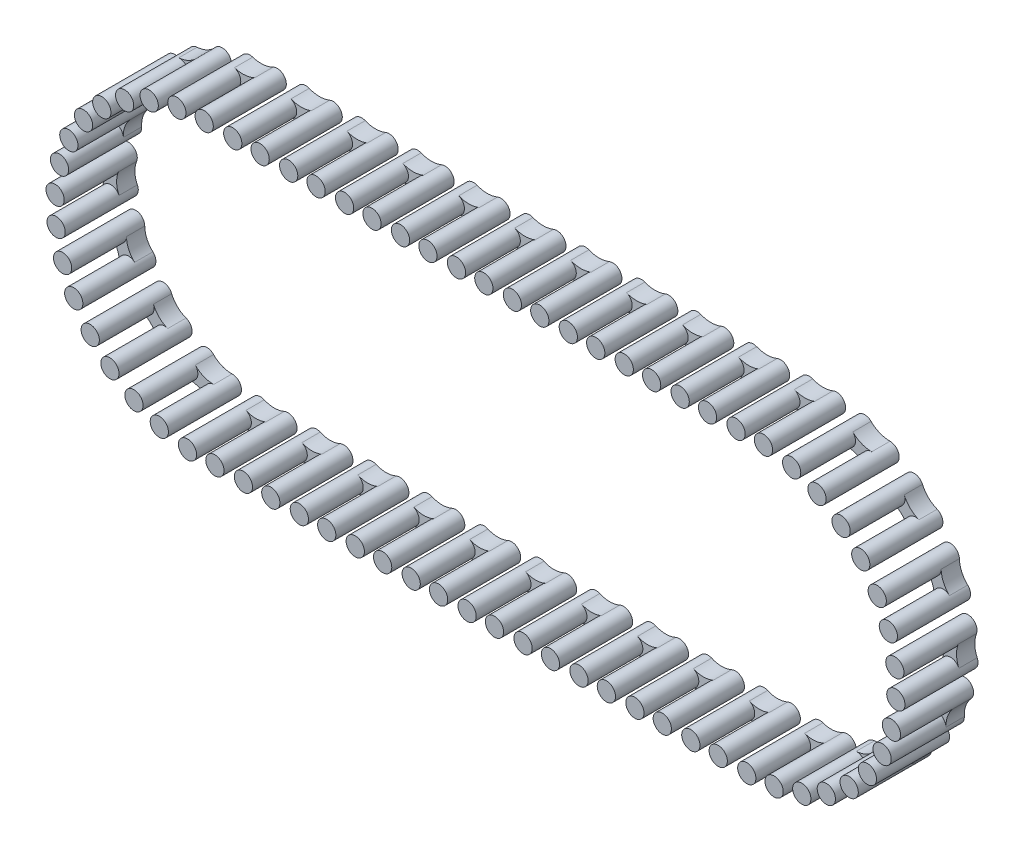
from build123d import *

# Parameters (mm, degrees)
BOSS_EXTRUDE1_DEPTH   = 2
CUT_EXTRUDE1_DEPTH    = 3
CRVPATTERN1_START     = -2
CRVPATTERN1_OUTLINE_R = 0.5
CRVPATTERN1_DEPTH     = 4
CRVPATTERN1_2_DEPTH   = 1


# Read off the part's stored shape, not the designer's step: CrvPattern1
with BuildPart() as part:
    # Sketch1 → Boss-Extrude1 (new, symmetric)
    with BuildSketch(Plane.XY):
        with BuildLine():
            ThreePointArc((10.132893716, 15.543142697), (10.608478721, 15.580721376), (10.836071975, 16))
            Line((10.836071975, 16), (9.836071975, 16))
            ThreePointArc((9.836071975, 16), (9.916793351, 15.727593254), (10.132893716, 15.543142697))
        make_face()
        with BuildLine():
            Line((9.836071975, 16), (10.836071975, 16))
            ThreePointArc((10.836071975, 16), (10.614498184, 16.415305726), (10.14615659, 16.462527995))
            ThreePointArc((10.14615659, 16.462527995), (9.920766249, 16.278426209), (9.836071975, 16))
        make_face()
        with BuildLine():
            Line((9.336071975, 16), (9.836071975, 16))
            ThreePointArc((9.836071975, 16), (9.920766249, 16.278426209), (10.14615659, 16.462527995))
            ThreePointArc((10.14615659, 16.462527995), (9.586071975, 16.35201829), (9.02598736, 16.462527995))
            ThreePointArc((9.02598736, 16.462527995), (9.251377702, 16.278426209), (9.336071975, 16))
        make_face()
        with BuildLine():
            ThreePointArc((9.039250234, 15.543142697), (9.2553506, 15.727593254), (9.336071975, 16))
            Line((9.336071975, 16), (8.336071975, 16))
            ThreePointArc((8.336071975, 16), (8.563665229, 15.580721376), (9.039250234, 15.543142697))
        make_face()
        with BuildLine():
            Line((8.336071975, 16), (9.336071975, 16))
            ThreePointArc((9.336071975, 16), (9.251377702, 16.278426209), (9.02598736, 16.462527995))
            ThreePointArc((9.02598736, 16.462527995), (8.557645767, 16.415305726), (8.336071975, 16))
        make_face()
        with BuildLine():
            ThreePointArc((9.039250234, 15.543142697), (9.2553506, 15.727593254), (9.336071975, 16))
            Line((9.336071975, 16), (8.336071975, 16))
            ThreePointArc((8.336071975, 16), (8.563665229, 15.580721376), (9.039250234, 15.543142697))
        make_face()
        with BuildLine():
            Line((8.336071975, 16), (9.336071975, 16))
            ThreePointArc((9.336071975, 16), (9.251377702, 16.278426209), (9.02598736, 16.462527995))
            ThreePointArc((9.02598736, 16.462527995), (8.557645767, 16.415305726), (8.336071975, 16))
        make_face()
        with BuildLine():
            ThreePointArc((10.132893716, 15.543142697), (9.916793351, 15.727593254), (9.836071975, 16))
            Line((9.836071975, 16), (9.336071975, 16))
            ThreePointArc((9.336071975, 16), (9.2553506, 15.727593254), (9.039250234, 15.543142697))
            ThreePointArc((9.039250234, 15.543142697), (9.586071975, 15.659254357), (10.132893716, 15.543142697))
        make_face()
        with BuildLine():
            ThreePointArc((10.132893716, 15.543142697), (10.608478721, 15.580721376), (10.836071975, 16))
            Line((10.836071975, 16), (9.836071975, 16))
            ThreePointArc((9.836071975, 16), (9.916793351, 15.727593254), (10.132893716, 15.543142697))
        make_face()
        with BuildLine():
            Line((9.836071975, 16), (10.836071975, 16))
            ThreePointArc((10.836071975, 16), (10.614498184, 16.415305726), (10.14615659, 16.462527995))
            ThreePointArc((10.14615659, 16.462527995), (9.920766249, 16.278426209), (9.836071975, 16))
        make_face()
    extrude(amount=BOSS_EXTRUDE1_DEPTH, both=True)

    # Sketch2 → Cut-Extrude1 (cut)
    with BuildSketch(Plane.XY.offset(2)):
        with BuildLine():
            ThreePointArc((9.039250234, 15.543142697), (9.336019957, 16.007212153), (9.02598736, 16.462527995))
            ThreePointArc((9.02598736, 16.462527995), (9.586071975, 16.35201829), (10.14615659, 16.462527995))
            ThreePointArc((10.14615659, 16.462527995), (9.836123993, 16.007212153), (10.132893716, 15.543142697))
            ThreePointArc((10.132893716, 15.543142697), (9.586071975, 15.659254357), (9.039250234, 15.543142697))
        make_face()
    extrude(amount=-CUT_EXTRUDE1_DEPTH, mode=Mode.SUBTRACT)


with BuildPart() as body_2:
    # CrvPattern1 outline → CrvPattern1 (new body)
    with BuildSketch(Plane.XY.offset(CRVPATTERN1_START)):
        with Locations((11.899002044, 16)):
            Circle(CRVPATTERN1_OUTLINE_R)
        with Locations((13.399002044, 16)):
            Circle(CRVPATTERN1_OUTLINE_R)
        with Locations((14.961932112, 16)):
            Circle(CRVPATTERN1_OUTLINE_R)
        with Locations((16.461932112, 16)):
            Circle(CRVPATTERN1_OUTLINE_R)
        with Locations((18.02486218, 16)):
            Circle(CRVPATTERN1_OUTLINE_R)
        with Locations((19.52486218, 16)):
            Circle(CRVPATTERN1_OUTLINE_R)
        with Locations((21.087792248, 16)):
            Circle(CRVPATTERN1_OUTLINE_R)
        with Locations((22.587792248, 16)):
            Circle(CRVPATTERN1_OUTLINE_R)
        with Locations((24.150722317, 16)):
            Circle(CRVPATTERN1_OUTLINE_R)
        with Locations((25.650722317, 16)):
            Circle(CRVPATTERN1_OUTLINE_R)
        with Locations((27.213654163, 16.002097164)):
            Circle(CRVPATTERN1_OUTLINE_R)
        with Locations((28.713648117, 15.99783835)):
            Circle(CRVPATTERN1_OUTLINE_R)
        with Locations((30.255580855, 15.694457115)):
            Circle(CRVPATTERN1_OUTLINE_R)
        with Locations((31.645380738, 15.130137805)):
            Circle(CRVPATTERN1_OUTLINE_R)
        with Locations((32.962336566, 14.272685713)):
            Circle(CRVPATTERN1_OUTLINE_R)
        with Locations((34.040692874, 13.230021975)):
            Circle(CRVPATTERN1_OUTLINE_R)
        with Locations((34.941970446, 11.942662088)):
            Circle(CRVPATTERN1_OUTLINE_R)
        with Locations((35.552732158, 10.572636493)):
            Circle(CRVPATTERN1_OUTLINE_R)
        with Locations((35.90782228, 9.041784525)):
            Circle(CRVPATTERN1_OUTLINE_R)
        with Locations((35.962548251, 7.542783168)):
            Circle(CRVPATTERN1_OUTLINE_R)
        with Locations((35.720032216, 5.990113624)):
            Circle(CRVPATTERN1_OUTLINE_R)
        with Locations((35.21079787, 4.579198892)):
            Circle(CRVPATTERN1_OUTLINE_R)
        with Locations((34.405793133, 3.229545561)):
            Circle(CRVPATTERN1_OUTLINE_R)
        with Locations((33.406337978, 2.111024487)):
            Circle(CRVPATTERN1_OUTLINE_R)
        with Locations((32.155412977, 1.159823466)):
            Circle(CRVPATTERN1_OUTLINE_R)
        with Locations((30.810462781, 0.495663116)):
            Circle(CRVPATTERN1_OUTLINE_R)
        with Locations((29.29475729, 0.080652749)):
            Circle(CRVPATTERN1_OUTLINE_R)
        with Locations((27.799067112, -0.03297336)):
            Circle(CRVPATTERN1_OUTLINE_R)
        with Locations((26.234595587, 0.000855204)):
            Circle(CRVPATTERN1_OUTLINE_R)
        with Locations((24.734595587, 0.000855204)):
            Circle(CRVPATTERN1_OUTLINE_R)
        with Locations((23.171665519, 0.000855204)):
            Circle(CRVPATTERN1_OUTLINE_R)
        with Locations((21.671665519, 0.000855204)):
            Circle(CRVPATTERN1_OUTLINE_R)
        with Locations((20.10873545, 0.000855204)):
            Circle(CRVPATTERN1_OUTLINE_R)
        with Locations((18.60873545, 0.000855204)):
            Circle(CRVPATTERN1_OUTLINE_R)
        with Locations((17.045805382, 0.000855204)):
            Circle(CRVPATTERN1_OUTLINE_R)
        with Locations((15.545805382, 0.000855204)):
            Circle(CRVPATTERN1_OUTLINE_R)
        with Locations((13.982875314, 0.000855204)):
            Circle(CRVPATTERN1_OUTLINE_R)
        with Locations((12.482875314, 0.000855204)):
            Circle(CRVPATTERN1_OUTLINE_R)
        with Locations((10.919945246, 0.000855204)):
            Circle(CRVPATTERN1_OUTLINE_R)
        with Locations((9.419945246, 0.000855204)):
            Circle(CRVPATTERN1_OUTLINE_R)
        with Locations((7.857015177, 0.000855204)):
            Circle(CRVPATTERN1_OUTLINE_R)
        with Locations((6.357015177, 0.000855204)):
            Circle(CRVPATTERN1_OUTLINE_R)
        with Locations((4.794085109, 0.000855204)):
            Circle(CRVPATTERN1_OUTLINE_R)
        with Locations((3.294085109, 0.000855204)):
            Circle(CRVPATTERN1_OUTLINE_R)
        with Locations((1.731155041, 0.000855204)):
            Circle(CRVPATTERN1_OUTLINE_R)
        with Locations((0.231155041, 0.000855204)):
            Circle(CRVPATTERN1_OUTLINE_R)
        with Locations((-1.331776806, -0.001241961)):
            Circle(CRVPATTERN1_OUTLINE_R)
        with Locations((-2.83177076, 0.003016854)):
            Circle(CRVPATTERN1_OUTLINE_R)
        with Locations((-4.373703497, 0.306398089)):
            Circle(CRVPATTERN1_OUTLINE_R)
        with Locations((-5.763503381, 0.870717399)):
            Circle(CRVPATTERN1_OUTLINE_R)
        with Locations((-7.080459208, 1.72816949)):
            Circle(CRVPATTERN1_OUTLINE_R)
        with Locations((-8.158815517, 2.770833229)):
            Circle(CRVPATTERN1_OUTLINE_R)
        with Locations((-9.060093089, 4.058193116)):
            Circle(CRVPATTERN1_OUTLINE_R)
        with BuildLine():
            ThreePointArc((-9.170855001, 5.4286664), (-10.170854751, 5.427994866), (-9.170854801, 5.428218711))
            ThreePointArc((-9.170854801, 5.428218711), (-9.170854782, 5.428442556), (-9.170855001, 5.4286664))
        make_face()
        with Locations((-10.025944922, 6.959070678)):
            Circle(CRVPATTERN1_OUTLINE_R)
        with Locations((-10.080670893, 8.458072035)):
            Circle(CRVPATTERN1_OUTLINE_R)
        with Locations((-9.838154859, 10.01074158)):
            Circle(CRVPATTERN1_OUTLINE_R)
        with Locations((-9.328920513, 11.421656312)):
            Circle(CRVPATTERN1_OUTLINE_R)
        with Locations((-8.523915775, 12.771309642)):
            Circle(CRVPATTERN1_OUTLINE_R)
        with Locations((-7.524460621, 13.889830717)):
            Circle(CRVPATTERN1_OUTLINE_R)
        with Locations((-6.27353562, 14.841031738)):
            Circle(CRVPATTERN1_OUTLINE_R)
        with Locations((-4.928585423, 15.505192087)):
            Circle(CRVPATTERN1_OUTLINE_R)
        with Locations((-3.412879933, 15.920202455)):
            Circle(CRVPATTERN1_OUTLINE_R)
        with Locations((-1.917189755, 16.033828564)):
            Circle(CRVPATTERN1_OUTLINE_R)
        with Locations((-0.35271823, 16)):
            Circle(CRVPATTERN1_OUTLINE_R)
        with Locations((1.14728177, 16)):
            Circle(CRVPATTERN1_OUTLINE_R)
        with Locations((2.710211839, 16)):
            Circle(CRVPATTERN1_OUTLINE_R)
        with Locations((4.210211839, 16)):
            Circle(CRVPATTERN1_OUTLINE_R)
        with Locations((5.773141907, 16)):
            Circle(CRVPATTERN1_OUTLINE_R)
        with Locations((7.273141907, 16)):
            Circle(CRVPATTERN1_OUTLINE_R)
    extrude(amount=CRVPATTERN1_DEPTH)

    # CrvPattern1 2 outline → CrvPattern1 2 (add)
    with BuildSketch(Plane.XY.offset(CRVPATTERN1_START)):
        with BuildLine():
            ThreePointArc((12.088917429, 16.462527995), (12.398950026, 16.007212152), (12.102180303, 15.543142697))
            ThreePointArc((12.102180303, 15.543142697), (12.649002044, 15.659254357), (13.195823784, 15.543142697))
            ThreePointArc((13.195823784, 15.543142697), (12.899054062, 16.007212152), (13.209086658, 16.462527995))
            ThreePointArc((13.209086658, 16.462527995), (12.649002044, 16.35201829), (12.088917429, 16.462527995))
        make_face()
        with BuildLine():
            ThreePointArc((15.151847497, 16.462527995), (15.461880094, 16.007212152), (15.165110371, 15.543142697))
            ThreePointArc((15.165110371, 15.543142697), (15.711932112, 15.659254357), (16.258753853, 15.543142697))
            ThreePointArc((16.258753853, 15.543142697), (15.96198413, 16.007212152), (16.272016727, 16.462527995))
            ThreePointArc((16.272016727, 16.462527995), (15.711932112, 16.35201829), (15.151847497, 16.462527995))
        make_face()
        with BuildLine():
            ThreePointArc((18.214777565, 16.462527995), (18.524810162, 16.007212152), (18.228040439, 15.543142697))
            ThreePointArc((18.228040439, 15.543142697), (18.77486218, 15.659254357), (19.321683921, 15.543142697))
            ThreePointArc((19.321683921, 15.543142697), (19.024914198, 16.007212152), (19.334946795, 16.462527995))
            ThreePointArc((19.334946795, 16.462527995), (18.77486218, 16.35201829), (18.214777565, 16.462527995))
        make_face()
        with BuildLine():
            ThreePointArc((21.277707634, 16.462527995), (21.58774023, 16.007212152), (21.290970507, 15.543142697))
            ThreePointArc((21.290970507, 15.543142697), (21.837792248, 15.659254357), (22.384613989, 15.543142697))
            ThreePointArc((22.384613989, 15.543142697), (22.087844266, 16.007212152), (22.397876863, 16.462527995))
            ThreePointArc((22.397876863, 16.462527995), (21.837792248, 16.35201829), (21.277707634, 16.462527995))
        make_face()
        with BuildLine():
            ThreePointArc((24.340637702, 16.462527995), (24.650670299, 16.007212152), (24.353900576, 15.543142697))
            ThreePointArc((24.353900576, 15.543142697), (24.900722317, 15.659254357), (25.447544057, 15.543142697))
            ThreePointArc((25.447544057, 15.543142697), (25.150774335, 16.007212152), (25.460806931, 16.462527995))
            ThreePointArc((25.460806931, 16.462527995), (24.900722316, 16.35201829), (24.340637702, 16.462527995))
        make_face()
        with BuildLine():
            ThreePointArc((27.404881997, 16.464084085), (27.713620607, 16.007889831), (27.41553449, 15.544664837))
            ThreePointArc((27.41553449, 15.544664837), (27.962683692, 15.659223487), (28.509173564, 15.541559754))
            ThreePointArc((28.509173564, 15.541559754), (28.213722627, 16.00646993), (28.525046711, 16.460903691))
            ThreePointArc((28.525046711, 16.460903691), (27.964650594, 16.351984628), (27.404881997, 16.464084085))
        make_face()
        with BuildLine():
            ThreePointArc((30.605552761, 16.051556072), (30.721512591, 15.513052547), (30.27195667, 15.194725354))
            ThreePointArc((30.27195667, 15.194725354), (30.822287899, 15.09658529), (31.285253726, 14.783282598))
            ThreePointArc((31.285253726, 14.783282598), (31.184875611, 15.324906971), (31.643426804, 15.630133987))
            ThreePointArc((31.643426804, 15.630133987), (31.082914609, 15.738454112), (30.605552761, 16.051556072))
        make_face()
        with BuildLine():
            ThreePointArc((33.420374981, 14.473187111), (33.326764506, 13.930352138), (32.790836575, 13.803018008))
            ThreePointArc((32.790836575, 13.803018008), (33.264659303, 13.506390368), (33.577061474, 13.042816407))
            ThreePointArc((33.577061474, 13.042816407), (33.6862914, 13.582725243), (34.225669351, 13.69454722))
            ThreePointArc((34.225669351, 13.69454722), (33.746205857, 14.004421273), (33.420374981, 14.473187111))
        make_face()
        with BuildLine():
            ThreePointArc((35.441749271, 11.957532389), (35.152123726, 11.488971005), (34.607428649, 11.571068512))
            ThreePointArc((34.607428649, 11.571068512), (34.936131134, 11.118906362), (35.052732359, 10.572188804))
            ThreePointArc((35.052732359, 10.572188804), (35.355753323, 11.032200785), (35.897853589, 10.934425379))
            ThreePointArc((35.897853589, 10.934425379), (35.568867347, 11.400982153), (35.441749271, 11.957532389))
        make_face()
        with BuildLine():
            ThreePointArc((36.376971211, 8.868870441), (35.933269724, 8.542432517), (35.458681887, 8.822073561))
            ThreePointArc((35.458681887, 8.822073561), (35.594666478, 8.279852089), (35.498582355, 7.729158186))
            ThreePointArc((35.498582355, 7.729158186), (35.95151551, 8.042661432), (36.417839443, 7.749446977))
            ThreePointArc((36.417839443, 7.749446977), (36.286969194, 8.305126875), (36.376971211, 8.868870441))
        make_face()
        with BuildLine():
            ThreePointArc((36.0906163, 5.65445392), (35.557088915, 5.517409191), (35.221330852, 5.954100444))
            ThreePointArc((35.221330852, 5.954100444), (35.144906345, 5.400335847), (34.850050303, 4.925408644))
            ThreePointArc((34.850050303, 4.925408644), (35.387308814, 5.047006424), (35.710330536, 4.600811741))
            ThreePointArc((35.710330536, 4.600811741), (35.796526904, 5.165149722), (36.0906163, 5.65445392))
        make_face()
        with BuildLine():
            ThreePointArc((34.624150066, 2.779745328), (34.078054038, 2.85193851), (33.92974508, 3.382445042))
            ThreePointArc((33.92974508, 3.382445042), (33.6519781, 2.897325017), (33.20104667, 2.566936187))
            ThreePointArc((33.20104667, 2.566936187), (33.744833, 2.479020574), (33.877777459, 1.944456735))
            ThreePointArc((33.877777459, 1.944456735), (34.168558806, 2.435734028), (34.624150066, 2.779745328))
        make_face()
        with BuildLine():
            ThreePointArc((32.189923657, 0.661015875), (31.710336236, 0.931993058), (31.770952214, 1.47949505))
            ThreePointArc((31.770952214, 1.47949505), (31.332064715, 1.133267238), (30.79035487, 0.995258625))
            ThreePointArc((30.79035487, 0.995258625), (31.261926223, 0.71056021), (31.185542441, 0.16503455))
            ThreePointArc((31.185542441, 0.16503455), (31.638802272, 0.512111913), (32.189923657, 0.661015875))
        make_face()
        with BuildLine():
            ThreePointArc((29.14042441, -0.394932535), (28.796792092, 0.035589889), (29.057555527, 0.520806499))
            ThreePointArc((29.057555527, 0.520806499), (28.521100467, 0.363606302), (27.967054318, 0.437962197))
            ThreePointArc((27.967054318, 0.437962197), (28.298124962, -0.002293361), (28.023473667, -0.479786182))
            ThreePointArc((28.023473667, -0.479786182), (28.573577847, -0.327167171), (29.14042441, -0.394932535))
        make_face()
        with BuildLine():
            ThreePointArc((26.044680202, -0.461672791), (25.734647605, -0.006356949), (26.031417328, 0.457712507))
            ThreePointArc((26.031417328, 0.457712507), (25.484595587, 0.341600847), (24.937773846, 0.457712506))
            ThreePointArc((24.937773846, 0.457712506), (25.234543569, -0.006356949), (24.924510972, -0.461672791))
            ThreePointArc((24.924510972, -0.461672791), (25.484595587, -0.351163086), (26.044680202, -0.461672791))
        make_face()
        with BuildLine():
            ThreePointArc((22.981750133, -0.461672791), (22.671717537, -0.006356949), (22.968487259, 0.457712506))
            ThreePointArc((22.968487259, 0.457712506), (22.421665518, 0.341600847), (21.874843778, 0.457712506))
            ThreePointArc((21.874843778, 0.457712506), (22.171613501, -0.006356949), (21.861580904, -0.461672791))
            ThreePointArc((21.861580904, -0.461672791), (22.421665518, -0.351163086), (22.981750133, -0.461672791))
        make_face()
        with BuildLine():
            ThreePointArc((19.918820065, -0.461672791), (19.608787468, -0.006356949), (19.905557191, 0.457712507))
            ThreePointArc((19.905557191, 0.457712507), (19.35873545, 0.341600847), (18.811913709, 0.457712506))
            ThreePointArc((18.811913709, 0.457712506), (19.108683432, -0.006356948), (18.798650836, -0.461672791))
            ThreePointArc((18.798650836, -0.461672791), (19.35873545, -0.351163086), (19.918820065, -0.461672791))
        make_face()
        with BuildLine():
            ThreePointArc((16.855889997, -0.461672791), (16.5458574, -0.006356949), (16.842627123, 0.457712507))
            ThreePointArc((16.842627123, 0.457712507), (16.295805382, 0.341600847), (15.748983641, 0.457712506))
            ThreePointArc((15.748983641, 0.457712506), (16.045753364, -0.006356949), (15.735720767, -0.461672791))
            ThreePointArc((15.735720767, -0.461672791), (16.295805382, -0.351163086), (16.855889997, -0.461672791))
        make_face()
        with BuildLine():
            ThreePointArc((13.792959929, -0.461672791), (13.482927332, -0.006356949), (13.779697055, 0.457712507))
            ThreePointArc((13.779697055, 0.457712507), (13.232875314, 0.341600847), (12.686053573, 0.457712506))
            ThreePointArc((12.686053573, 0.457712506), (12.982823296, -0.006356949), (12.672790699, -0.461672791))
            ThreePointArc((12.672790699, -0.461672791), (13.232875314, -0.351163086), (13.792959929, -0.461672791))
        make_face()
        with BuildLine():
            ThreePointArc((10.73002986, -0.461672791), (10.419997264, -0.006356949), (10.716766986, 0.457712506))
            ThreePointArc((10.716766986, 0.457712506), (10.169945246, 0.341600847), (9.623123505, 0.457712506))
            ThreePointArc((9.623123505, 0.457712506), (9.919893228, -0.006356949), (9.609860631, -0.461672791))
            ThreePointArc((9.609860631, -0.461672791), (10.169945246, -0.351163086), (10.73002986, -0.461672791))
        make_face()
        with BuildLine():
            ThreePointArc((7.667099792, -0.461672791), (7.357067195, -0.006356949), (7.653836918, 0.457712507))
            ThreePointArc((7.653836918, 0.457712507), (7.107015177, 0.341600847), (6.560193436, 0.457712506))
            ThreePointArc((6.560193436, 0.457712506), (6.856963159, -0.006356948), (6.546930563, -0.461672791))
            ThreePointArc((6.546930563, -0.461672791), (7.107015178, -0.351163086), (7.667099792, -0.461672791))
        make_face()
        with BuildLine():
            ThreePointArc((4.604169724, -0.461672791), (4.294137127, -0.006356949), (4.59090685, 0.457712507))
            ThreePointArc((4.59090685, 0.457712507), (4.044085109, 0.341600847), (3.497263368, 0.457712506))
            ThreePointArc((3.497263368, 0.457712506), (3.794033091, -0.006356949), (3.484000494, -0.461672791))
            ThreePointArc((3.484000494, -0.461672791), (4.044085109, -0.351163086), (4.604169724, -0.461672791))
        make_face()
        with BuildLine():
            ThreePointArc((1.541239656, -0.461672791), (1.231207059, -0.006356949), (1.527976782, 0.457712507))
            ThreePointArc((1.527976782, 0.457712507), (0.981155041, 0.341600847), (0.4343333, 0.457712506))
            ThreePointArc((0.4343333, 0.457712506), (0.731103023, -0.006356949), (0.421070426, -0.461672791))
            ThreePointArc((0.421070426, -0.461672791), (0.981155041, -0.351163086), (1.541239656, -0.461672791))
        make_face()
        with BuildLine():
            ThreePointArc((-1.523004639, -0.463228883), (-1.83174325, -0.007034627), (-1.533657132, 0.456190366))
            ThreePointArc((-1.533657132, 0.456190366), (-2.080806334, 0.341631716), (-2.627296206, 0.459295449))
            ThreePointArc((-2.627296206, 0.459295449), (-2.33184527, -0.005614727), (-2.643169354, -0.460048487))
            ThreePointArc((-2.643169354, -0.460048487), (-2.082773236, -0.351129424), (-1.523004639, -0.463228883))
        make_face()
        with BuildLine():
            ThreePointArc((-4.723675403, -0.050700867), (-4.839635233, 0.487802656), (-4.390079313, 0.80612985))
            ThreePointArc((-4.390079313, 0.80612985), (-4.940410542, 0.904269914), (-5.403376368, 1.217572606))
            ThreePointArc((-5.403376368, 1.217572606), (-5.302998254, 0.675948233), (-5.761549447, 0.370721217))
            ThreePointArc((-5.761549447, 0.370721217), (-5.201037251, 0.262401092), (-4.723675403, -0.050700867))
        make_face()
        with BuildLine():
            ThreePointArc((-7.538497623, 1.527668093), (-7.444887148, 2.070503064), (-6.908959218, 2.197837195))
            ThreePointArc((-6.908959218, 2.197837195), (-7.382781945, 2.494464836), (-7.695184117, 2.958038796))
            ThreePointArc((-7.695184117, 2.958038796), (-7.804414043, 2.418129961), (-8.343791994, 2.306307984))
            ThreePointArc((-8.343791994, 2.306307984), (-7.8643285, 1.996433931), (-7.538497623, 1.527668093))
        make_face()
        with BuildLine():
            ThreePointArc((-9.559871914, 4.043322815), (-9.270246368, 4.511884199), (-8.725551291, 4.429786692))
            ThreePointArc((-8.725551291, 4.429786692), (-9.054162616, 4.881744401), (-9.170854526, 5.428218711))
            ThreePointArc((-9.170854526, 5.428218711), (-9.474081728, 4.96856628), (-10.015976232, 5.066429825))
            ThreePointArc((-10.015976232, 5.066429825), (-9.68698999, 4.599873051), (-9.559871914, 4.043322815))
        make_face()
        with BuildLine():
            ThreePointArc((-10.495093853, 7.131984763), (-10.051392365, 7.458422686), (-9.576804529, 7.178781642))
            ThreePointArc((-9.576804529, 7.178781642), (-9.71278912, 7.721003115), (-9.616704997, 8.271697018))
            ThreePointArc((-9.616704997, 8.271697018), (-10.069638151, 7.958193771), (-10.535962086, 8.251408226))
            ThreePointArc((-10.535962086, 8.251408226), (-10.405091837, 7.695728329), (-10.495093853, 7.131984763))
        make_face()
        with BuildLine():
            ThreePointArc((-10.208738943, 10.346401284), (-9.675211558, 10.483446013), (-9.339453495, 10.046754759))
            ThreePointArc((-9.339453495, 10.046754759), (-9.263028987, 10.600519356), (-8.968172946, 11.075446559))
            ThreePointArc((-8.968172946, 11.075446559), (-9.505431457, 10.95384878), (-9.828453179, 11.400043463))
            ThreePointArc((-9.828453179, 11.400043463), (-9.914649547, 10.835705482), (-10.208738943, 10.346401284))
        make_face()
        with BuildLine():
            ThreePointArc((-8.742272708, 13.221109875), (-8.19617668, 13.148916693), (-8.047867722, 12.618410161))
            ThreePointArc((-8.047867722, 12.618410161), (-7.770100743, 13.103530187), (-7.319169312, 13.433919016))
            ThreePointArc((-7.319169312, 13.433919016), (-7.862955643, 13.52183463), (-7.995900102, 14.056398469))
            ThreePointArc((-7.995900102, 14.056398469), (-8.286681448, 13.565121176), (-8.742272708, 13.221109875))
        make_face()
        with BuildLine():
            ThreePointArc((-6.3080463, 15.339839329), (-5.828458879, 15.068862146), (-5.889074857, 14.521360154))
            ThreePointArc((-5.889074857, 14.521360154), (-5.450187358, 14.867587966), (-4.908477513, 15.005596579))
            ThreePointArc((-4.908477513, 15.005596579), (-5.380048865, 15.290294994), (-5.303665083, 15.835820653))
            ThreePointArc((-5.303665083, 15.835820653), (-5.756924915, 15.488743291), (-6.3080463, 15.339839329))
        make_face()
        with BuildLine():
            ThreePointArc((-3.258547053, 16.395787739), (-2.914914735, 15.965265315), (-3.17567817, 15.480048705))
            ThreePointArc((-3.17567817, 15.480048705), (-2.63922311, 15.637248902), (-2.085176961, 15.562893007))
            ThreePointArc((-2.085176961, 15.562893007), (-2.416247605, 16.003148565), (-2.14159631, 16.480641386))
            ThreePointArc((-2.14159631, 16.480641386), (-2.69170049, 16.328022375), (-3.258547053, 16.395787739))
        make_face()
        with BuildLine():
            ThreePointArc((-0.162802844, 16.462527995), (0.147229752, 16.007212152), (-0.14953997, 15.543142698))
            ThreePointArc((-0.14953997, 15.543142698), (0.39728177, 15.659254357), (0.944103511, 15.543142697))
            ThreePointArc((0.944103511, 15.543142697), (0.647333788, 16.007212152), (0.957366385, 16.462527995))
            ThreePointArc((0.957366385, 16.462527995), (0.39728177, 16.35201829), (-0.162802844, 16.462527995))
        make_face()
        with BuildLine():
            ThreePointArc((2.900127224, 16.462527995), (3.210159821, 16.007212152), (2.913390098, 15.543142697))
            ThreePointArc((2.913390098, 15.543142697), (3.460211839, 15.659254357), (4.00703358, 15.543142697))
            ThreePointArc((4.00703358, 15.543142697), (3.710263857, 16.007212152), (4.020296453, 16.462527995))
            ThreePointArc((4.020296453, 16.462527995), (3.460211839, 16.35201829), (2.900127224, 16.462527995))
        make_face()
        with BuildLine():
            ThreePointArc((5.963057292, 16.462527995), (6.273089889, 16.007212152), (5.976320166, 15.543142697))
            ThreePointArc((5.976320166, 15.543142697), (6.523141907, 15.659254357), (7.069963648, 15.543142697))
            ThreePointArc((7.069963648, 15.543142697), (6.773193925, 16.007212152), (7.083226522, 16.462527995))
            ThreePointArc((7.083226522, 16.462527995), (6.523141907, 16.35201829), (5.963057292, 16.462527995))
        make_face()
    extrude(amount=CRVPATTERN1_2_DEPTH)


solid = Compound([part.part, body_2.part])
